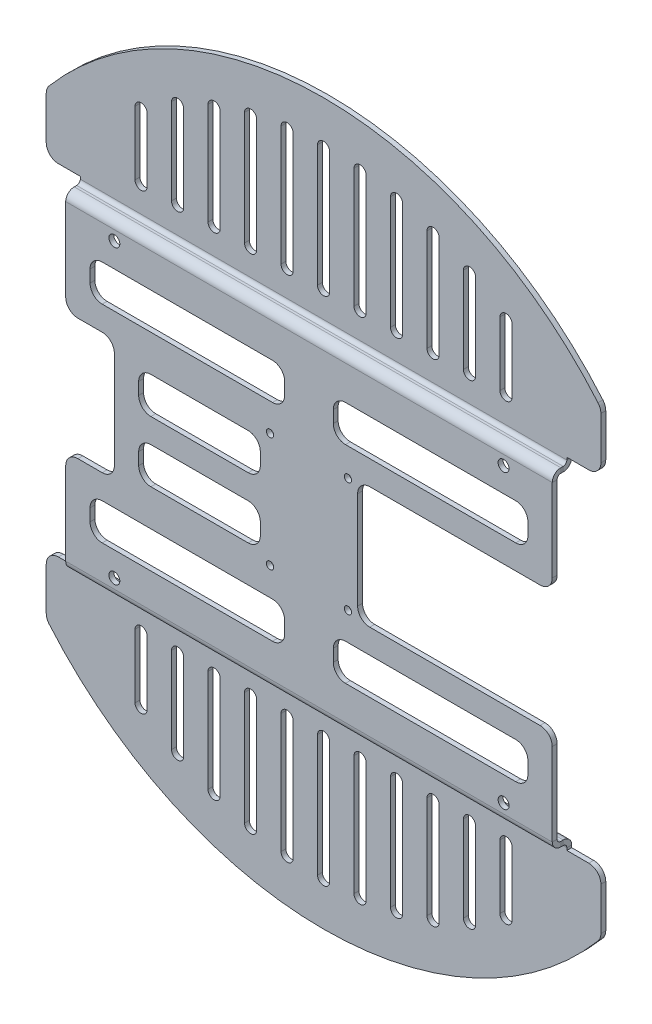
from build123d import *

# Parameters (mm, degrees)
ESQUISSE1_W                             = 228
ESQUISSE1_H                             = 131
BOSS_EXTRU_1_DEPTH                      = 2
T_LE_PLI_E_SUR_AR_TE1_STRIP_W           = 11
T_LE_PLI_E_SUR_AR_TE1_STRIP_H           = 2
T_LE_PLI_E_SUR_AR_TE1_STRIP_CUT_DEPTH   = 228
T_LE_PLI_E_SUR_AR_TE1_STRIP_2_W         = 11
T_LE_PLI_E_SUR_AR_TE1_STRIP_2_H         = 2
T_LE_PLI_E_SUR_AR_TE1_STRIP_CUT_2_DEPTH = 228
T_LE_PLI_E_SUR_AR_TE1_DEPTH             = 228
T_LE_PLI_E_SUR_AR_TE1_BEND_DEPTH        = 228
T_LE_PLI_E_SUR_AR_TE2_STRIP_W           = 11
T_LE_PLI_E_SUR_AR_TE2_STRIP_H           = 2
T_LE_PLI_E_SUR_AR_TE2_STRIP_CUT_DEPTH   = 228
T_LE_PLI_E_SUR_AR_TE2_STRIP_2_W         = 11
T_LE_PLI_E_SUR_AR_TE2_STRIP_2_H         = 2
T_LE_PLI_E_SUR_AR_TE2_STRIP_CUT_2_DEPTH = 228
T_LE_PLI_E_SUR_AR_TE2_DEPTH             = 228
T_LE_PLI_E_SUR_AR_TE2_BEND_DEPTH        = 228
ESQUISSE12_OUTSIDE_W                    = 305.856
ESQUISSE12_OUTSIDE_H                    = 380.856
ESQUISSE12_OUTSIDE_R                    = 148
ENL_V_MAT_EXTRU_1_DEPTH                 = 10
ENL_V_MAT_EXTRU_2_REACH                 = 188.987
ESQUISSE14_W                            = 30
ESQUISSE14_H                            = 140
ENL_V_MAT_EXTRU_3_REACH                 = 188.987
ESQUISSE15_R                            = 2.25
ESQUISSE15_R_2                          = 1.5
ENL_V_MAT_EXTRU_9_DEPTH                 = 10
CONG_1_R                                = 5
ENL_V_MAT_EXTRU_4_REACH                 = 188.987


# Sheet-metal steps are written as plain solids
with BuildPart() as part:
    # Esquisse1 → Boss.-Extru.1 (new body)
    with BuildSketch(Plane.XY):
        Rectangle(ESQUISSE1_W, ESQUISSE1_H)
    extrude(amount=BOSS_EXTRU_1_DEPTH)

    # Tôle pliée sur arête1 strip (across the edge) → Tôle pliée sur arête1 strip cut (cut)
    with BuildSketch(Plane(origin=(-114, 65.5, 0), x_dir=(0, -1, 0), z_dir=(1, 0, 0))):
        with Locations((-4, -1)):
            Rectangle(T_LE_PLI_E_SUR_AR_TE1_STRIP_W, T_LE_PLI_E_SUR_AR_TE1_STRIP_H)
    extrude(amount=T_LE_PLI_E_SUR_AR_TE1_STRIP_CUT_DEPTH, mode=Mode.SUBTRACT)

    # Tôle pliée sur arête1 strip 2 (across the edge) → Tôle pliée sur arête1 strip cut 2 (cut)
    with BuildSketch(Plane(origin=(114, -65.5, 0), x_dir=(0, 1, 0), z_dir=(-1, 0, 0))):
        with Locations((-4, -1)):
            Rectangle(T_LE_PLI_E_SUR_AR_TE1_STRIP_2_W, T_LE_PLI_E_SUR_AR_TE1_STRIP_2_H)
    extrude(amount=T_LE_PLI_E_SUR_AR_TE1_STRIP_CUT_2_DEPTH, mode=Mode.SUBTRACT)

    # Tôle pliée sur arête1 section (across the edge) → Tôle pliée sur arête1 (add)
    with BuildSketch(Plane(origin=(-114, 65.5, 0), x_dir=(0, -1, 0), z_dir=(1, 0, 0))):
        with BuildLine():
            Line((-2, 1.5), (-2, 4))
            Line((-2, 4), (0, 4))
            Line((0, 4), (0, 1.5))
            ThreePointArc((0, 1.5), (0.439339828, 0.439339828), (1.5, 0))
            Line((1.5, 0), (1.5, -2))
            ThreePointArc((1.5, -2), (-0.974873734, -0.974873734), (-2, 1.5))
        make_face()
    extrude(amount=T_LE_PLI_E_SUR_AR_TE1_DEPTH)

    # Tôle pliée sur arête1 section 2 (across the edge) → Tôle pliée sur arête1 bend (add)
    with BuildSketch(Plane(origin=(114, -65.5, 0), x_dir=(0, 1, 0), z_dir=(-1, 0, 0))):
        with BuildLine():
            Line((-2, 1.5), (-2, 4))
            Line((-2, 4), (0, 4))
            Line((0, 4), (0, 1.5))
            ThreePointArc((0, 1.5), (0.439339828, 0.439339828), (1.5, 0))
            Line((1.5, 0), (1.5, -2))
            ThreePointArc((1.5, -2), (-0.974873734, -0.974873734), (-2, 1.5))
        make_face()
    extrude(amount=T_LE_PLI_E_SUR_AR_TE1_BEND_DEPTH)

    # Tôle pliée sur arête2 strip (across the edge) → Tôle pliée sur arête2 strip cut (cut)
    with BuildSketch(Plane(origin=(114, 67.5, -4), x_dir=(0, 0, 1), z_dir=(-1, 0, 0))):
        with Locations((-4, -1)):
            Rectangle(T_LE_PLI_E_SUR_AR_TE2_STRIP_W, T_LE_PLI_E_SUR_AR_TE2_STRIP_H)
    extrude(amount=T_LE_PLI_E_SUR_AR_TE2_STRIP_CUT_DEPTH, mode=Mode.SUBTRACT)

    # Tôle pliée sur arête2 strip 2 (across the edge) → Tôle pliée sur arête2 strip cut 2 (cut)
    with BuildSketch(Plane(origin=(-114, -67.5, -4), x_dir=(0, 0, 1), z_dir=(1, 0, 0))):
        with Locations((-4, -1)):
            Rectangle(T_LE_PLI_E_SUR_AR_TE2_STRIP_2_W, T_LE_PLI_E_SUR_AR_TE2_STRIP_2_H)
    extrude(amount=T_LE_PLI_E_SUR_AR_TE2_STRIP_CUT_2_DEPTH, mode=Mode.SUBTRACT)

    # Tôle pliée sur arête2 section (across the edge) → Tôle pliée sur arête2 (add)
    with BuildSketch(Plane(origin=(114, 67.5, -4), x_dir=(0, 0, 1), z_dir=(-1, 0, 0))):
        with BuildLine():
            Line((-2, 1.5), (-2, 84))
            Line((-2, 84), (0, 84))
            Line((0, 84), (0, 1.5))
            ThreePointArc((0, 1.5), (0.439339828, 0.439339828), (1.5, 0))
            Line((1.5, 0), (1.5, -2))
            ThreePointArc((1.5, -2), (-0.974873734, -0.974873734), (-2, 1.5))
        make_face()
    extrude(amount=T_LE_PLI_E_SUR_AR_TE2_DEPTH)

    # Tôle pliée sur arête2 section 2 (across the edge) → Tôle pliée sur arête2 bend (add)
    with BuildSketch(Plane(origin=(-114, -67.5, -4), x_dir=(0, 0, 1), z_dir=(1, 0, 0))):
        with BuildLine():
            Line((-2, 1.5), (-2, 84))
            Line((-2, 84), (0, 84))
            Line((0, 84), (0, 1.5))
            ThreePointArc((0, 1.5), (0.439339828, 0.439339828), (1.5, 0))
            Line((1.5, 0), (1.5, -2))
            ThreePointArc((1.5, -2), (-0.974873734, -0.974873734), (-2, 1.5))
        make_face()
    extrude(amount=T_LE_PLI_E_SUR_AR_TE2_BEND_DEPTH)

    # Esquisse12 outside → Enlèv. mat.-Extru.1 (cut)
    with BuildSketch(Plane.XY.offset(2)):
        Rectangle(ESQUISSE12_OUTSIDE_W, ESQUISSE12_OUTSIDE_H)
        Circle(ESQUISSE12_OUTSIDE_R, mode=Mode.SUBTRACT)
    extrude(amount=-ENL_V_MAT_EXTRU_1_DEPTH, mode=Mode.SUBTRACT)

    # Esquisse14 → Enlèv. mat.-Extru.2 (cut, up to next)
    with BuildSketch(Plane.XY.offset(2), mode=Mode.PRIVATE) as enl_v_mat_extru_2_sk1:
        with Locations((-115, 0)):
            Rectangle(ESQUISSE14_W, ESQUISSE14_H)
    enl_v_mat_extru_2_tool1 = extrude(enl_v_mat_extru_2_sk1.sketch, amount=-ENL_V_MAT_EXTRU_2_REACH, mode=Mode.PRIVATE) & part.part
    # Esquisse14 → Enlèv. mat.-Extru.2 (cut, up to next)
    with BuildSketch(Plane.XY.offset(2), mode=Mode.PRIVATE) as enl_v_mat_extru_2_sk2:
        with Locations((115, 0)):
            Rectangle(ESQUISSE14_W, ESQUISSE14_H)
    enl_v_mat_extru_2_tool2 = extrude(enl_v_mat_extru_2_sk2.sketch, amount=-ENL_V_MAT_EXTRU_2_REACH, mode=Mode.PRIVATE) & part.part
    add(enl_v_mat_extru_2_tool1.solids().sort_by_distance((-115, 0, 2))[0], mode=Mode.SUBTRACT)
    add(enl_v_mat_extru_2_tool2.solids().sort_by_distance((115, 0, 2))[0], mode=Mode.SUBTRACT)

    # Esquisse15 → Enlèv. mat.-Extru.3 (cut, up to next)
    with BuildSketch(Plane.XY.offset(2), mode=Mode.PRIVATE) as enl_v_mat_extru_3_sk1:
        with Locations((-80, 60)):
            Circle(ESQUISSE15_R)
    enl_v_mat_extru_3_tool1 = extrude(enl_v_mat_extru_3_sk1.sketch, amount=-ENL_V_MAT_EXTRU_3_REACH, mode=Mode.PRIVATE) & part.part
    # Esquisse15 → Enlèv. mat.-Extru.3 (cut, up to next)
    with BuildSketch(Plane.XY.offset(2), mode=Mode.PRIVATE) as enl_v_mat_extru_3_sk2:
        with Locations((-80, -60)):
            Circle(ESQUISSE15_R)
    enl_v_mat_extru_3_tool2 = extrude(enl_v_mat_extru_3_sk2.sketch, amount=-ENL_V_MAT_EXTRU_3_REACH, mode=Mode.PRIVATE) & part.part
    # Esquisse15 → Enlèv. mat.-Extru.3 (cut, up to next)
    with BuildSketch(Plane.XY.offset(2), mode=Mode.PRIVATE) as enl_v_mat_extru_3_sk3:
        with Locations((80, 60)):
            Circle(ESQUISSE15_R)
    enl_v_mat_extru_3_tool3 = extrude(enl_v_mat_extru_3_sk3.sketch, amount=-ENL_V_MAT_EXTRU_3_REACH, mode=Mode.PRIVATE) & part.part
    # Esquisse15 → Enlèv. mat.-Extru.3 (cut, up to next)
    with BuildSketch(Plane.XY.offset(2), mode=Mode.PRIVATE) as enl_v_mat_extru_3_sk4:
        with Locations((80, -60)):
            Circle(ESQUISSE15_R)
    enl_v_mat_extru_3_tool4 = extrude(enl_v_mat_extru_3_sk4.sketch, amount=-ENL_V_MAT_EXTRU_3_REACH, mode=Mode.PRIVATE) & part.part
    # Esquisse15 → Enlèv. mat.-Extru.3 (cut, up to next)
    with BuildSketch(Plane.XY.offset(2), mode=Mode.PRIVATE) as enl_v_mat_extru_3_sk5:
        with Locations((-16, 23.5)):
            Circle(ESQUISSE15_R_2)
    enl_v_mat_extru_3_tool5 = extrude(enl_v_mat_extru_3_sk5.sketch, amount=-ENL_V_MAT_EXTRU_3_REACH, mode=Mode.PRIVATE) & part.part
    # Esquisse15 → Enlèv. mat.-Extru.3 (cut, up to next)
    with BuildSketch(Plane.XY.offset(2), mode=Mode.PRIVATE) as enl_v_mat_extru_3_sk6:
        with Locations((16, 23.5)):
            Circle(ESQUISSE15_R_2)
    enl_v_mat_extru_3_tool6 = extrude(enl_v_mat_extru_3_sk6.sketch, amount=-ENL_V_MAT_EXTRU_3_REACH, mode=Mode.PRIVATE) & part.part
    # Esquisse15 → Enlèv. mat.-Extru.3 (cut, up to next)
    with BuildSketch(Plane.XY.offset(2), mode=Mode.PRIVATE) as enl_v_mat_extru_3_sk7:
        with Locations((-16, -23.5)):
            Circle(ESQUISSE15_R_2)
    enl_v_mat_extru_3_tool7 = extrude(enl_v_mat_extru_3_sk7.sketch, amount=-ENL_V_MAT_EXTRU_3_REACH, mode=Mode.PRIVATE) & part.part
    # Esquisse15 → Enlèv. mat.-Extru.3 (cut, up to next)
    with BuildSketch(Plane.XY.offset(2), mode=Mode.PRIVATE) as enl_v_mat_extru_3_sk8:
        with Locations((16, -23.5)):
            Circle(ESQUISSE15_R_2)
    enl_v_mat_extru_3_tool8 = extrude(enl_v_mat_extru_3_sk8.sketch, amount=-ENL_V_MAT_EXTRU_3_REACH, mode=Mode.PRIVATE) & part.part
    add(enl_v_mat_extru_3_tool1.solids().sort_by_distance((-80, 60, 2))[0], mode=Mode.SUBTRACT)
    add(enl_v_mat_extru_3_tool2.solids().sort_by_distance((-80, -60, 2))[0], mode=Mode.SUBTRACT)
    add(enl_v_mat_extru_3_tool3.solids().sort_by_distance((80, 60, 2))[0], mode=Mode.SUBTRACT)
    add(enl_v_mat_extru_3_tool4.solids().sort_by_distance((80, -60, 2))[0], mode=Mode.SUBTRACT)
    add(enl_v_mat_extru_3_tool5.solids().sort_by_distance((-16, 23.5, 2))[0], mode=Mode.SUBTRACT)
    add(enl_v_mat_extru_3_tool6.solids().sort_by_distance((16, 23.5, 2))[0], mode=Mode.SUBTRACT)
    add(enl_v_mat_extru_3_tool7.solids().sort_by_distance((-16, -23.5, 2))[0], mode=Mode.SUBTRACT)
    add(enl_v_mat_extru_3_tool8.solids().sort_by_distance((16, -23.5, 2))[0], mode=Mode.SUBTRACT)

    # Esquisse18 → Enlèv. mat.-Extru.9 (cut)
    with BuildSketch(Plane.XY):
        with BuildLine():
            Line((15, -35), (85, -35))
            ThreePointArc((85, -35), (88.535533906, -36.464466094), (90, -40))
            Line((90, -40), (90, -45))
            ThreePointArc((90, -45), (88.535533906, -48.535533906), (85, -50))
            Line((85, -50), (15, -50))
            ThreePointArc((15, -50), (11.464466094, -48.535533906), (10, -45))
            Line((10, -45), (10, -40))
            ThreePointArc((10, -40), (11.464466094, -36.464466094), (15, -35))
        make_face()
        with BuildLine():
            Line((-90, 45), (-90, 40))
            ThreePointArc((-90, 40), (-88.535533906, 36.464466094), (-85, 35))
            Line((-85, 35), (-15, 35))
            ThreePointArc((-15, 35), (-11.464466094, 36.464466094), (-10, 40))
            Line((-10, 40), (-10, 45))
            ThreePointArc((-10, 45), (-11.464466094, 48.535533906), (-15, 50))
            Line((-15, 50), (-85, 50))
            ThreePointArc((-85, 50), (-88.535533906, 48.535533906), (-90, 45))
        make_face()
        with BuildLine():
            Line((25, 25), (110, 25))
            Line((110, 25), (110, -25))
            Line((110, -25), (25, -25))
            ThreePointArc((25, -25), (21.464466094, -23.535533906), (20, -20))
            Line((20, -20), (20, 20))
            ThreePointArc((20, 20), (21.464466094, 23.535533906), (25, 25))
        make_face()
        with BuildLine():
            Line((15, 50), (85, 50))
            ThreePointArc((85, 50), (88.535533906, 48.535533906), (90, 45))
            Line((90, 45), (90, 40))
            ThreePointArc((90, 40), (88.535533906, 36.464466094), (85, 35))
            Line((85, 35), (15, 35))
            ThreePointArc((15, 35), (11.464466094, 36.464466094), (10, 40))
            Line((10, 40), (10, 45))
            ThreePointArc((10, 45), (11.464466094, 48.535533906), (15, 50))
        make_face()
        with BuildLine():
            Line((-150.208373778, 25), (-85, 25))
            ThreePointArc((-85, 25), (-81.464466094, 23.535533906), (-80, 20))
            Line((-80, 20), (-80, -20))
            ThreePointArc((-80, -20), (-81.464466094, -23.535533906), (-85, -25))
            Line((-85, -25), (-150.208373778, -25))
            Line((-150.208373778, -25), (-150.208373778, 25))
        make_face()
        with BuildLine():
            Line((-65, 20), (-25, 20))
            ThreePointArc((-25, 20), (-21.464466094, 18.535533906), (-20, 15))
            Line((-20, 15), (-20, 10))
            ThreePointArc((-20, 10), (-21.464466094, 6.464466094), (-25, 5))
            Line((-25, 5), (-65, 5))
            ThreePointArc((-65, 5), (-68.535533906, 6.464466094), (-70, 10))
            Line((-70, 10), (-70, 15))
            ThreePointArc((-70, 15), (-68.535533906, 18.535533906), (-65, 20))
        make_face()
        with BuildLine():
            Line((-65, -5), (-25, -5))
            ThreePointArc((-25, -5), (-21.464466094, -6.464466094), (-20, -10))
            Line((-20, -10), (-20, -15))
            ThreePointArc((-20, -15), (-21.464466094, -18.535533906), (-25, -20))
            Line((-25, -20), (-65, -20))
            ThreePointArc((-65, -20), (-68.535533906, -18.535533906), (-70, -15))
            Line((-70, -15), (-70, -10))
            ThreePointArc((-70, -10), (-68.535533906, -6.464466094), (-65, -5))
        make_face()
        with BuildLine():
            Line((-85, -50), (-15, -50))
            ThreePointArc((-15, -50), (-11.464466094, -48.535533906), (-10, -45))
            Line((-10, -45), (-10, -40))
            ThreePointArc((-10, -40), (-11.464466094, -36.464466094), (-15, -35))
            Line((-15, -35), (-85, -35))
            ThreePointArc((-85, -35), (-88.535533906, -36.464466094), (-90, -40))
            Line((-90, -40), (-90, -45))
            ThreePointArc((-90, -45), (-88.535533906, -48.535533906), (-85, -50))
        make_face()
    extrude(amount=ENL_V_MAT_EXTRU_9_DEPTH, mode=Mode.SUBTRACT)

    # Congé1
    cong_1_edges = [part.edges().sort_by_distance(p)[0] for p in [
        (114, -94.382201712, -5),
        (-114, -94.382201712, -5),
        (-114, 94.382201712, -5),
        (114, 94.382201712, -5),
        (-114, 70, -5),
        (-114, -70, -5),
        (114, 70, -5),
        (114, -70, -5),
        (100, -25, 1),
        (100, 25, 1),
        (-100, 25, 1),
        (-100, -25, 1),
    ]]
    fillet(cong_1_edges, radius=CONG_1_R)

    # Esquisse16 → Enlèv. mat.-Extru.4 (cut, up to next)
    with BuildSketch(Plane(origin=(0, 0, -6), x_dir=(-1, 0, 0), z_dir=(0, 0, -1)), mode=Mode.PRIVATE) as enl_v_mat_extru_4_sk1:
        with BuildLine():
            Line((12.5, 80), (12.5, 129.131715701))
            ThreePointArc((12.5, 129.131715701), (15, 131.631715701), (17.5, 129.131715701))
            Line((17.5, 129.131715701), (17.5, 80))
            ThreePointArc((17.5, 80), (15, 77.5), (12.5, 80))
        make_face()
    enl_v_mat_extru_4_tool1 = extrude(enl_v_mat_extru_4_sk1.sketch, amount=-ENL_V_MAT_EXTRU_4_REACH, mode=Mode.PRIVATE) & part.part
    # Esquisse16 → Enlèv. mat.-Extru.4 (cut, up to next)
    with BuildSketch(Plane(origin=(0, 0, -6), x_dir=(-1, 0, 0), z_dir=(0, 0, -1)), mode=Mode.PRIVATE) as enl_v_mat_extru_4_sk2:
        with BuildLine():
            Line((-2.5, 130), (-2.5, 80))
            ThreePointArc((-2.5, 80), (0, 77.5), (2.5, 80))
            Line((2.5, 80), (2.5, 130))
            ThreePointArc((2.5, 130), (0, 132.5), (-2.5, 130))
        make_face()
    enl_v_mat_extru_4_tool2 = extrude(enl_v_mat_extru_4_sk2.sketch, amount=-ENL_V_MAT_EXTRU_4_REACH, mode=Mode.PRIVATE) & part.part
    # Esquisse16 → Enlèv. mat.-Extru.4 (cut, up to next)
    with BuildSketch(Plane(origin=(0, 0, -6), x_dir=(-1, 0, 0), z_dir=(0, 0, -1)), mode=Mode.PRIVATE) as enl_v_mat_extru_4_sk3:
        with BuildLine():
            Line((27.5, 80), (27.5, 126.491106407))
            ThreePointArc((27.5, 126.491106407), (30, 128.991106407), (32.5, 126.491106407))
            Line((32.5, 126.491106407), (32.5, 80))
            ThreePointArc((32.5, 80), (30, 77.5), (27.5, 80))
        make_face()
    enl_v_mat_extru_4_tool3 = extrude(enl_v_mat_extru_4_sk3.sketch, amount=-ENL_V_MAT_EXTRU_4_REACH, mode=Mode.PRIVATE) & part.part
    # Esquisse16 → Enlèv. mat.-Extru.4 (cut, up to next)
    with BuildSketch(Plane(origin=(0, 0, -6), x_dir=(-1, 0, 0), z_dir=(0, 0, -1)), mode=Mode.PRIVATE) as enl_v_mat_extru_4_sk4:
        with BuildLine():
            Line((42.5, 80), (42.5, 121.855500994))
            ThreePointArc((42.5, 121.855500994), (45, 124.355500994), (47.5, 121.855500994))
            Line((47.5, 121.855500994), (47.5, 80))
            ThreePointArc((47.5, 80), (45, 77.5), (42.5, 80))
        make_face()
    enl_v_mat_extru_4_tool4 = extrude(enl_v_mat_extru_4_sk4.sketch, amount=-ENL_V_MAT_EXTRU_4_REACH, mode=Mode.PRIVATE) & part.part
    # Esquisse16 → Enlèv. mat.-Extru.4 (cut, up to next)
    with BuildSketch(Plane(origin=(0, 0, -6), x_dir=(-1, 0, 0), z_dir=(0, 0, -1)), mode=Mode.PRIVATE) as enl_v_mat_extru_4_sk5:
        with BuildLine():
            Line((57.5, 80), (57.5, 115.325625947))
            ThreePointArc((57.5, 115.325625947), (60, 117.825625947), (62.5, 115.325625947))
            Line((62.5, 115.325625947), (62.5, 80))
            ThreePointArc((62.5, 80), (60, 77.5), (57.5, 80))
        make_face()
    enl_v_mat_extru_4_tool5 = extrude(enl_v_mat_extru_4_sk5.sketch, amount=-ENL_V_MAT_EXTRU_4_REACH, mode=Mode.PRIVATE) & part.part
    # Esquisse16 → Enlèv. mat.-Extru.4 (cut, up to next)
    with BuildSketch(Plane(origin=(0, 0, -6), x_dir=(-1, 0, 0), z_dir=(0, 0, -1)), mode=Mode.PRIVATE) as enl_v_mat_extru_4_sk6:
        with BuildLine():
            Line((72.5, 80), (72.5, 106.183802908))
            ThreePointArc((72.5, 106.183802908), (75, 108.683802908), (77.5, 106.183802908))
            Line((77.5, 106.183802908), (77.5, 80))
            ThreePointArc((77.5, 80), (75, 77.5), (72.5, 80))
        make_face()
    enl_v_mat_extru_4_tool6 = extrude(enl_v_mat_extru_4_sk6.sketch, amount=-ENL_V_MAT_EXTRU_4_REACH, mode=Mode.PRIVATE) & part.part
    # Esquisse16 → Enlèv. mat.-Extru.4 (cut, up to next)
    with BuildSketch(Plane(origin=(0, 0, -6), x_dir=(-1, 0, 0), z_dir=(0, 0, -1)), mode=Mode.PRIVATE) as enl_v_mat_extru_4_sk7:
        with BuildLine():
            Line((-17.5, 80), (-17.5, 129.131715701))
            ThreePointArc((-17.5, 129.131715701), (-15, 131.631715701), (-12.5, 129.131715701))
            Line((-12.5, 129.131715701), (-12.5, 80))
            ThreePointArc((-12.5, 80), (-15, 77.5), (-17.5, 80))
        make_face()
    enl_v_mat_extru_4_tool7 = extrude(enl_v_mat_extru_4_sk7.sketch, amount=-ENL_V_MAT_EXTRU_4_REACH, mode=Mode.PRIVATE) & part.part
    # Esquisse16 → Enlèv. mat.-Extru.4 (cut, up to next)
    with BuildSketch(Plane(origin=(0, 0, -6), x_dir=(-1, 0, 0), z_dir=(0, 0, -1)), mode=Mode.PRIVATE) as enl_v_mat_extru_4_sk8:
        with BuildLine():
            Line((-32.5, 80), (-32.5, 126.491106407))
            ThreePointArc((-32.5, 126.491106407), (-30, 128.991106407), (-27.5, 126.491106407))
            Line((-27.5, 126.491106407), (-27.5, 80))
            ThreePointArc((-27.5, 80), (-30, 77.5), (-32.5, 80))
        make_face()
    enl_v_mat_extru_4_tool8 = extrude(enl_v_mat_extru_4_sk8.sketch, amount=-ENL_V_MAT_EXTRU_4_REACH, mode=Mode.PRIVATE) & part.part
    # Esquisse16 → Enlèv. mat.-Extru.4 (cut, up to next)
    with BuildSketch(Plane(origin=(0, 0, -6), x_dir=(-1, 0, 0), z_dir=(0, 0, -1)), mode=Mode.PRIVATE) as enl_v_mat_extru_4_sk9:
        with BuildLine():
            Line((-42.5, 80), (-42.5, 121.855500994))
            ThreePointArc((-42.5, 121.855500994), (-45, 124.355500994), (-47.5, 121.855500994))
            Line((-47.5, 121.855500994), (-47.5, 80))
            ThreePointArc((-47.5, 80), (-45, 77.5), (-42.5, 80))
        make_face()
    enl_v_mat_extru_4_tool9 = extrude(enl_v_mat_extru_4_sk9.sketch, amount=-ENL_V_MAT_EXTRU_4_REACH, mode=Mode.PRIVATE) & part.part
    # Esquisse16 → Enlèv. mat.-Extru.4 (cut, up to next)
    with BuildSketch(Plane(origin=(0, 0, -6), x_dir=(-1, 0, 0), z_dir=(0, 0, -1)), mode=Mode.PRIVATE) as enl_v_mat_extru_4_sk10:
        with BuildLine():
            Line((-57.5, 80), (-57.5, 115.325625947))
            ThreePointArc((-57.5, 115.325625947), (-60, 117.825625947), (-62.5, 115.325625947))
            Line((-62.5, 115.325625947), (-62.5, 80))
            ThreePointArc((-62.5, 80), (-60, 77.5), (-57.5, 80))
        make_face()
    enl_v_mat_extru_4_tool10 = extrude(enl_v_mat_extru_4_sk10.sketch, amount=-ENL_V_MAT_EXTRU_4_REACH, mode=Mode.PRIVATE) & part.part
    # Esquisse16 → Enlèv. mat.-Extru.4 (cut, up to next)
    with BuildSketch(Plane(origin=(0, 0, -6), x_dir=(-1, 0, 0), z_dir=(0, 0, -1)), mode=Mode.PRIVATE) as enl_v_mat_extru_4_sk11:
        with BuildLine():
            Line((-72.5, 80), (-72.5, 106.183802908))
            ThreePointArc((-72.5, 106.183802908), (-75, 108.683802908), (-77.5, 106.183802908))
            Line((-77.5, 106.183802908), (-77.5, 80))
            ThreePointArc((-77.5, 80), (-75, 77.5), (-72.5, 80))
        make_face()
    enl_v_mat_extru_4_tool11 = extrude(enl_v_mat_extru_4_sk11.sketch, amount=-ENL_V_MAT_EXTRU_4_REACH, mode=Mode.PRIVATE) & part.part
    # Esquisse16 → Enlèv. mat.-Extru.4 (cut, up to next)
    with BuildSketch(Plane(origin=(0, 0, -6), x_dir=(-1, 0, 0), z_dir=(0, 0, -1)), mode=Mode.PRIVATE) as enl_v_mat_extru_4_sk12:
        with BuildLine():
            Line((77.5, -80), (77.5, -106.183802908))
            ThreePointArc((77.5, -106.183802908), (75, -108.683802908), (72.5, -106.183802908))
            Line((72.5, -106.183802908), (72.5, -80))
            ThreePointArc((72.5, -80), (75, -77.5), (77.5, -80))
        make_face()
    enl_v_mat_extru_4_tool12 = extrude(enl_v_mat_extru_4_sk12.sketch, amount=-ENL_V_MAT_EXTRU_4_REACH, mode=Mode.PRIVATE) & part.part
    # Esquisse16 → Enlèv. mat.-Extru.4 (cut, up to next)
    with BuildSketch(Plane(origin=(0, 0, -6), x_dir=(-1, 0, 0), z_dir=(0, 0, -1)), mode=Mode.PRIVATE) as enl_v_mat_extru_4_sk13:
        with BuildLine():
            Line((62.5, -80), (62.5, -115.325625947))
            ThreePointArc((62.5, -115.325625947), (60, -117.825625947), (57.5, -115.325625947))
            Line((57.5, -115.325625947), (57.5, -80))
            ThreePointArc((57.5, -80), (60, -77.5), (62.5, -80))
        make_face()
    enl_v_mat_extru_4_tool13 = extrude(enl_v_mat_extru_4_sk13.sketch, amount=-ENL_V_MAT_EXTRU_4_REACH, mode=Mode.PRIVATE) & part.part
    # Esquisse16 → Enlèv. mat.-Extru.4 (cut, up to next)
    with BuildSketch(Plane(origin=(0, 0, -6), x_dir=(-1, 0, 0), z_dir=(0, 0, -1)), mode=Mode.PRIVATE) as enl_v_mat_extru_4_sk14:
        with BuildLine():
            Line((47.5, -80), (47.5, -121.963109177))
            ThreePointArc((47.5, -121.963109177), (45, -124.463109177), (42.5, -121.963109177))
            Line((42.5, -121.963109177), (42.5, -80))
            ThreePointArc((42.5, -80), (45, -77.5), (47.5, -80))
        make_face()
    enl_v_mat_extru_4_tool14 = extrude(enl_v_mat_extru_4_sk14.sketch, amount=-ENL_V_MAT_EXTRU_4_REACH, mode=Mode.PRIVATE) & part.part
    # Esquisse16 → Enlèv. mat.-Extru.4 (cut, up to next)
    with BuildSketch(Plane(origin=(0, 0, -6), x_dir=(-1, 0, 0), z_dir=(0, 0, -1)), mode=Mode.PRIVATE) as enl_v_mat_extru_4_sk15:
        with BuildLine():
            Line((32.5, -80), (32.5, -126.491106407))
            ThreePointArc((32.5, -126.491106407), (30, -128.991106407), (27.5, -126.491106407))
            Line((27.5, -126.491106407), (27.5, -80))
            ThreePointArc((27.5, -80), (30, -77.5), (32.5, -80))
        make_face()
    enl_v_mat_extru_4_tool15 = extrude(enl_v_mat_extru_4_sk15.sketch, amount=-ENL_V_MAT_EXTRU_4_REACH, mode=Mode.PRIVATE) & part.part
    # Esquisse16 → Enlèv. mat.-Extru.4 (cut, up to next)
    with BuildSketch(Plane(origin=(0, 0, -6), x_dir=(-1, 0, 0), z_dir=(0, 0, -1)), mode=Mode.PRIVATE) as enl_v_mat_extru_4_sk16:
        with BuildLine():
            Line((17.5, -80), (17.5, -129.131715701))
            ThreePointArc((17.5, -129.131715701), (15, -131.631715701), (12.5, -129.131715701))
            Line((12.5, -129.131715701), (12.5, -80))
            ThreePointArc((12.5, -80), (15, -77.5), (17.5, -80))
        make_face()
    enl_v_mat_extru_4_tool16 = extrude(enl_v_mat_extru_4_sk16.sketch, amount=-ENL_V_MAT_EXTRU_4_REACH, mode=Mode.PRIVATE) & part.part
    # Esquisse16 → Enlèv. mat.-Extru.4 (cut, up to next)
    with BuildSketch(Plane(origin=(0, 0, -6), x_dir=(-1, 0, 0), z_dir=(0, 0, -1)), mode=Mode.PRIVATE) as enl_v_mat_extru_4_sk17:
        with BuildLine():
            Line((2.5, -80), (2.5, -130))
            ThreePointArc((2.5, -130), (0, -132.5), (-2.5, -130))
            Line((-2.5, -130), (-2.5, -80))
            ThreePointArc((-2.5, -80), (0, -77.5), (2.5, -80))
        make_face()
    enl_v_mat_extru_4_tool17 = extrude(enl_v_mat_extru_4_sk17.sketch, amount=-ENL_V_MAT_EXTRU_4_REACH, mode=Mode.PRIVATE) & part.part
    # Esquisse16 → Enlèv. mat.-Extru.4 (cut, up to next)
    with BuildSketch(Plane(origin=(0, 0, -6), x_dir=(-1, 0, 0), z_dir=(0, 0, -1)), mode=Mode.PRIVATE) as enl_v_mat_extru_4_sk18:
        with BuildLine():
            Line((-12.5, -80), (-12.5, -129.131715701))
            ThreePointArc((-12.5, -129.131715701), (-15, -131.631715701), (-17.5, -129.131715701))
            Line((-17.5, -129.131715701), (-17.5, -80))
            ThreePointArc((-17.5, -80), (-15, -77.5), (-12.5, -80))
        make_face()
    enl_v_mat_extru_4_tool18 = extrude(enl_v_mat_extru_4_sk18.sketch, amount=-ENL_V_MAT_EXTRU_4_REACH, mode=Mode.PRIVATE) & part.part
    # Esquisse16 → Enlèv. mat.-Extru.4 (cut, up to next)
    with BuildSketch(Plane(origin=(0, 0, -6), x_dir=(-1, 0, 0), z_dir=(0, 0, -1)), mode=Mode.PRIVATE) as enl_v_mat_extru_4_sk19:
        with BuildLine():
            Line((-27.5, -80), (-27.5, -126.491106407))
            ThreePointArc((-27.5, -126.491106407), (-30, -128.991106407), (-32.5, -126.491106407))
            Line((-32.5, -126.491106407), (-32.5, -80))
            ThreePointArc((-32.5, -80), (-30, -77.5), (-27.5, -80))
        make_face()
    enl_v_mat_extru_4_tool19 = extrude(enl_v_mat_extru_4_sk19.sketch, amount=-ENL_V_MAT_EXTRU_4_REACH, mode=Mode.PRIVATE) & part.part
    # Esquisse16 → Enlèv. mat.-Extru.4 (cut, up to next)
    with BuildSketch(Plane(origin=(0, 0, -6), x_dir=(-1, 0, 0), z_dir=(0, 0, -1)), mode=Mode.PRIVATE) as enl_v_mat_extru_4_sk20:
        with BuildLine():
            Line((-42.5, -80), (-42.5, -121.963109177))
            ThreePointArc((-42.5, -121.963109177), (-45, -124.463109177), (-47.5, -121.963109177))
            Line((-47.5, -121.963109177), (-47.5, -80))
            ThreePointArc((-47.5, -80), (-45, -77.5), (-42.5, -80))
        make_face()
    enl_v_mat_extru_4_tool20 = extrude(enl_v_mat_extru_4_sk20.sketch, amount=-ENL_V_MAT_EXTRU_4_REACH, mode=Mode.PRIVATE) & part.part
    # Esquisse16 → Enlèv. mat.-Extru.4 (cut, up to next)
    with BuildSketch(Plane(origin=(0, 0, -6), x_dir=(-1, 0, 0), z_dir=(0, 0, -1)), mode=Mode.PRIVATE) as enl_v_mat_extru_4_sk21:
        with BuildLine():
            Line((-57.5, -80), (-57.5, -115.325625947))
            ThreePointArc((-57.5, -115.325625947), (-60, -117.825625947), (-62.5, -115.325625947))
            Line((-62.5, -115.325625947), (-62.5, -80))
            ThreePointArc((-62.5, -80), (-60, -77.5), (-57.5, -80))
        make_face()
    enl_v_mat_extru_4_tool21 = extrude(enl_v_mat_extru_4_sk21.sketch, amount=-ENL_V_MAT_EXTRU_4_REACH, mode=Mode.PRIVATE) & part.part
    # Esquisse16 → Enlèv. mat.-Extru.4 (cut, up to next)
    with BuildSketch(Plane(origin=(0, 0, -6), x_dir=(-1, 0, 0), z_dir=(0, 0, -1)), mode=Mode.PRIVATE) as enl_v_mat_extru_4_sk22:
        with BuildLine():
            Line((-72.5, -80), (-72.5, -106.183802908))
            ThreePointArc((-72.5, -106.183802908), (-75, -108.683802908), (-77.5, -106.183802908))
            Line((-77.5, -106.183802908), (-77.5, -80))
            ThreePointArc((-77.5, -80), (-75, -77.5), (-72.5, -80))
        make_face()
    enl_v_mat_extru_4_tool22 = extrude(enl_v_mat_extru_4_sk22.sketch, amount=-ENL_V_MAT_EXTRU_4_REACH, mode=Mode.PRIVATE) & part.part
    add(enl_v_mat_extru_4_tool1.solids().sort_by_distance((-15, 104.565858, -6))[0], mode=Mode.SUBTRACT)
    add(enl_v_mat_extru_4_tool2.solids().sort_by_distance((0, 105, -6))[0], mode=Mode.SUBTRACT)
    add(enl_v_mat_extru_4_tool3.solids().sort_by_distance((-30, 103.245553, -6))[0], mode=Mode.SUBTRACT)
    add(enl_v_mat_extru_4_tool4.solids().sort_by_distance((-45, 100.92775, -6))[0], mode=Mode.SUBTRACT)
    add(enl_v_mat_extru_4_tool5.solids().sort_by_distance((-60, 97.662813, -6))[0], mode=Mode.SUBTRACT)
    add(enl_v_mat_extru_4_tool6.solids().sort_by_distance((-75, 93.091901, -6))[0], mode=Mode.SUBTRACT)
    add(enl_v_mat_extru_4_tool7.solids().sort_by_distance((15, 104.565858, -6))[0], mode=Mode.SUBTRACT)
    add(enl_v_mat_extru_4_tool8.solids().sort_by_distance((30, 103.245553, -6))[0], mode=Mode.SUBTRACT)
    add(enl_v_mat_extru_4_tool9.solids().sort_by_distance((45, 100.92775, -6))[0], mode=Mode.SUBTRACT)
    add(enl_v_mat_extru_4_tool10.solids().sort_by_distance((60, 97.662813, -6))[0], mode=Mode.SUBTRACT)
    add(enl_v_mat_extru_4_tool11.solids().sort_by_distance((75, 93.091901, -6))[0], mode=Mode.SUBTRACT)
    add(enl_v_mat_extru_4_tool12.solids().sort_by_distance((-75, -93.091901, -6))[0], mode=Mode.SUBTRACT)
    add(enl_v_mat_extru_4_tool13.solids().sort_by_distance((-60, -97.662813, -6))[0], mode=Mode.SUBTRACT)
    add(enl_v_mat_extru_4_tool14.solids().sort_by_distance((-45, -100.981555, -6))[0], mode=Mode.SUBTRACT)
    add(enl_v_mat_extru_4_tool15.solids().sort_by_distance((-30, -103.245553, -6))[0], mode=Mode.SUBTRACT)
    add(enl_v_mat_extru_4_tool16.solids().sort_by_distance((-15, -104.565858, -6))[0], mode=Mode.SUBTRACT)
    add(enl_v_mat_extru_4_tool17.solids().sort_by_distance((0, -105, -6))[0], mode=Mode.SUBTRACT)
    add(enl_v_mat_extru_4_tool18.solids().sort_by_distance((15, -104.565858, -6))[0], mode=Mode.SUBTRACT)
    add(enl_v_mat_extru_4_tool19.solids().sort_by_distance((30, -103.245553, -6))[0], mode=Mode.SUBTRACT)
    add(enl_v_mat_extru_4_tool20.solids().sort_by_distance((45, -100.981555, -6))[0], mode=Mode.SUBTRACT)
    add(enl_v_mat_extru_4_tool21.solids().sort_by_distance((60, -97.662813, -6))[0], mode=Mode.SUBTRACT)
    add(enl_v_mat_extru_4_tool22.solids().sort_by_distance((75, -93.091901, -6))[0], mode=Mode.SUBTRACT)


solid = part.part
